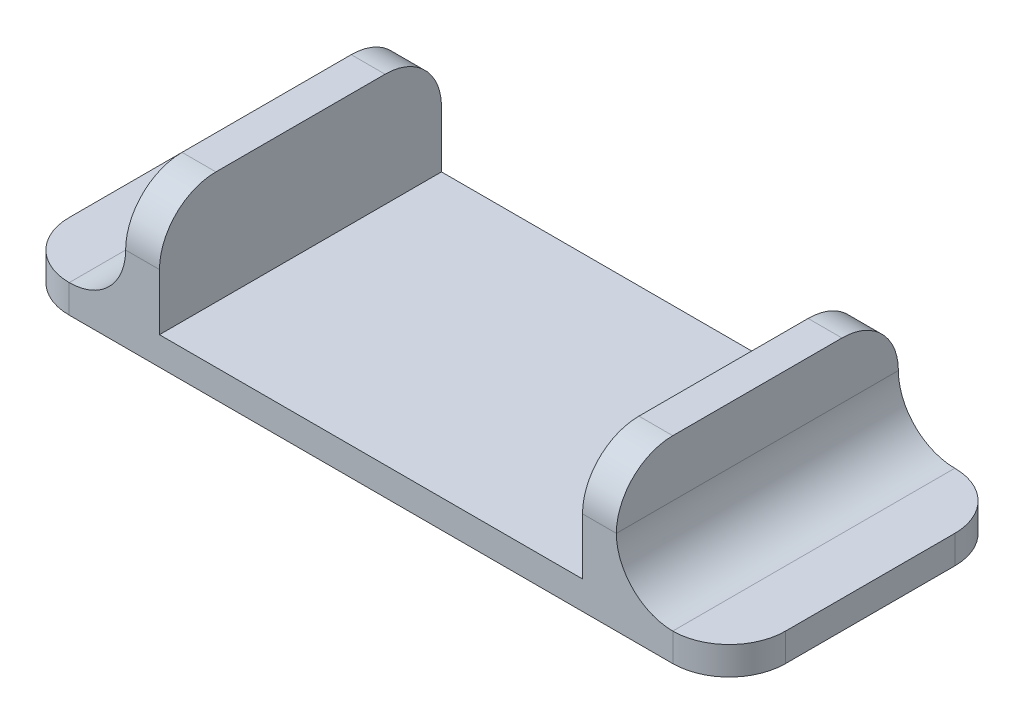
from build123d import *

# Parameters (mm, degrees)
BOSS_EXTRUDE1_DEPTH = 50
FILLET1_R           = 10
BOSS_EXTRUDE2_DEPTH = 1
BOSS_EXTRUDE3_START = 1
BOSS_EXTRUDE3_DEPTH = 1
SKETCH4_W           = 87
SKETCH4_H           = 20
CUT_EXTRUDE1_DEPTH  = 93
FILLET2_R           = 10


with BuildPart() as part:
    # Sketch1 → Boss-Extrude1 (new body)
    with BuildSketch(Plane.XY):
        Polygon((0, 0), (-77, 0), (-77, 40), (-82, 40), (-82, 0), (-102, 0), (-102, -5), (25, -5), (25, 0), (5, 0), (5, 40), (0, 40), align=None)
    extrude(amount=BOSS_EXTRUDE1_DEPTH)

    # Fillet1
    fillet1_edges = [part.edges().sort_by_distance(p)[0] for p in [
        (25, -2.5, 0),
        (25, -2.5, 50),
        (-102, -2.5, 0),
        (-102, -2.5, 50),
        (2.5, 40, 50),
        (2.5, 40, 0),
        (-79.5, 40, 0),
        (-79.5, 40, 50),
        (-82, 0, 25),
        (5, 0, 25),
    ]]
    fillet(fillet1_edges, radius=FILLET1_R - 0.0001)  # a hair under: the kernel refuses the full size

    # Sketch2 → Boss-Extrude2 (add)
    with BuildSketch(Plane(origin=(-77, 0, 0), x_dir=(0, 0, -1), z_dir=(1, 0, 0))):
        with BuildLine():
            Line((0, 0), (0, 30))
            ThreePointArc((0, 30), (-2.928932188, 37.071067812), (-10, 40))
            Line((-10, 40), (-40, 40))
            ThreePointArc((-40, 40), (-47.071067812, 37.071067812), (-50, 30))
            Line((-50, 30), (-50, 0))
            Line((-50, 0), (0, 0))
        make_face()
    extrude(amount=BOSS_EXTRUDE2_DEPTH)

    # Sketch3 → Boss-Extrude3 (add)
    with BuildSketch(Plane.ZY.offset(BOSS_EXTRUDE3_START)):
        with BuildLine():
            Line((50, 0), (50, 30))
            ThreePointArc((50, 30), (47.071067812, 37.071067812), (40, 40))
            Line((40, 40), (10, 40))
            ThreePointArc((10, 40), (2.928932188, 37.071067812), (0, 30))
            Line((0, 30), (0, 0))
            Line((0, 0), (50, 0))
        make_face()
    extrude(amount=-BOSS_EXTRUDE3_DEPTH)

    # Sketch4 → Cut-Extrude1 (cut)
    with BuildSketch(Plane.XY.offset(50)):
        with Locations((-38.5, 30)):
            Rectangle(SKETCH4_W, SKETCH4_H)
    extrude(amount=-CUT_EXTRUDE1_DEPTH, mode=Mode.SUBTRACT)

    # Fillet2
    fillet2_edges = [part.edges().sort_by_distance(p)[0] for p in [
        (2, 20, 0),
        (2, 20, 50),
        (-79, 20, 0),
        (-79, 20, 50),
    ]]
    fillet(fillet2_edges, radius=FILLET2_R)


solid = part.part
